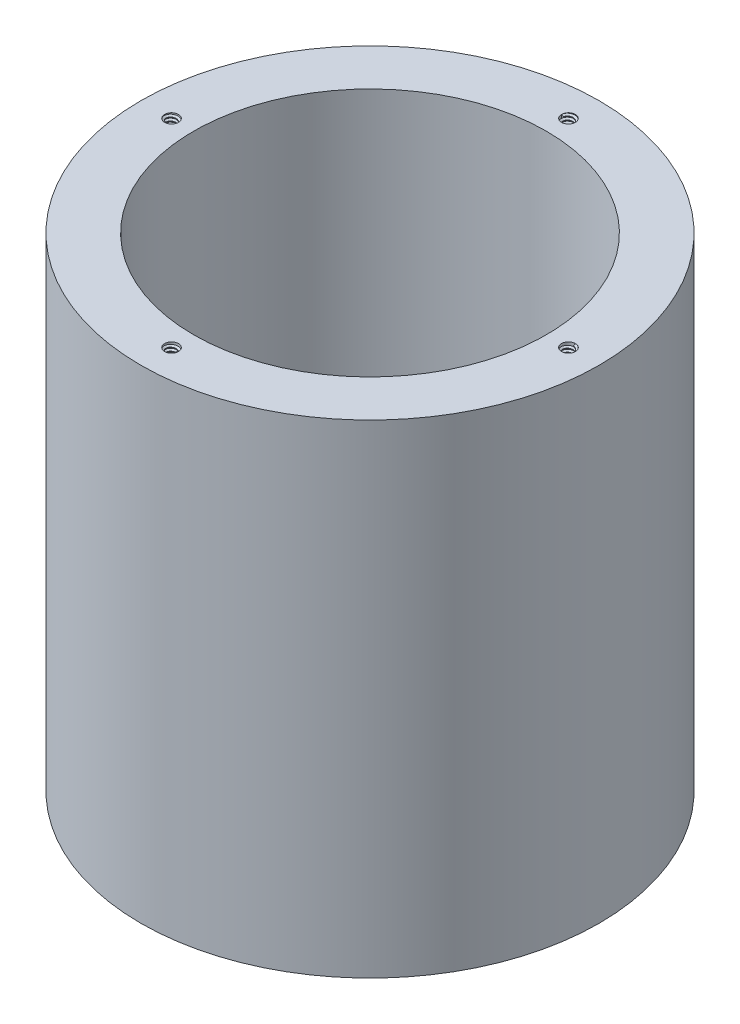
from build123d import *
from build123d.topology import SkipClean

# Parameters (mm, degrees)
SKETCH1_R           = 16.5
SKETCH1_R_2         = 12.7
BOSS_EXTRUDE1_DEPTH = 34.8
SKETCH2_R           = 0.5
CUT_EXTRUDE1_DEPTH  = 2
THREAD1_PITCH       = 0.25
CIRPATTERN1_COUNT   = 4
CUT_EXTRUDE2_START  = -2
SKETCH5_R           = 0.5
CUT_EXTRUDE2_DEPTH  = 2
THREAD2_PITCH       = 0.25
CIRPATTERN2_COUNT   = 4


with BuildPart() as part:
    # Sketch1 → Boss-Extrude1 (new body)
    with BuildSketch(Plane(origin=(0, 0, 0), x_dir=(1, 0, 0), z_dir=(0, 1, 0))):
        with Locations(Location((0, 0, 0), (0, 0, 270))):
            Circle(SKETCH1_R)
        with Locations(Location((0, 0, 0), (0, 0, 270))):
            Circle(SKETCH1_R_2, mode=Mode.SUBTRACT)
    extrude(amount=BOSS_EXTRUDE1_DEPTH)

    # Sketch2 → Cut-Extrude1 (cut)
    with BuildSketch(Plane(origin=(0, 34.8, 0), x_dir=(1, 0, 0), z_dir=(0, 1, 0))):
        with Locations(Location((0, 14.29, 0), (0, 0, 270))):
            Circle(SKETCH2_R)
    cut_extrude1 = extrude(amount=-CUT_EXTRUDE1_DEPTH, mode=Mode.SUBTRACT)

    # Thread1: the profile of Thread Profile1 profile screwed along a right-hand helix of 8 turns, 6 arcs to a turn; built about Z, then put on its axis
    with SkipClean():  # the faces are left unmerged after this step: merging them gives an invalid solid
        thread1_z = Axis((0, 0, 0), (0, 0, 1))
        thread1_corners = [(0.5003, 0, -0.000173205), (0.5003, 0, 0.218923204), (0.364683531, 0, 0.140625), (0.364683531, 0, 0.078125)]
        with BuildLine(mode=Mode.PRIVATE) as thread1_profile:
            Line(thread1_corners[0], thread1_corners[1])
            Line(thread1_corners[1], thread1_corners[2])
            Line(thread1_corners[2], thread1_corners[3])
            Line(thread1_corners[3], thread1_corners[0])
        thread1_cap = Face(thread1_profile.wire())
        thread1_turn_angles = [0, 30, 60, 90, 120, 150, 180, 210, 240, 270, 300, 330, 360]
        thread1_turn_weights = [1, 0.8660254037844387, 1, 0.8660254037844387, 1, 0.8660254037844387, 1, 0.8660254037844387, 1, 0.8660254037844387, 1, 0.8660254037844387, 1]
        thread1_turn_rails = [Edge.make_bspline([Vector(p[0], p[1], 0).rotate(thread1_z, thread1_turn_angles[k]) / thread1_turn_weights[k] + Vector(0, 0, p[2] + THREAD1_PITCH * thread1_turn_angles[k] / 360) for k in range(13)], [0, 0, 0, 1, 1, 2, 2, 3, 3, 4, 4, 5, 5, 6, 6, 6], 2, thread1_turn_weights) for p in thread1_corners]
        thread1_turn_sides = [Face.make_surface_from_curves(thread1_turn_rails[p[0]], thread1_turn_rails[p[1]]) for p in [(0, 1), (1, 2), (2, 3), (3, 0)]]
        thread1 = Plane(origin=(0, 34.8, -14.29), x_dir=(-1, 0, 0), z_dir=(0, -1, 0)) * Solid(Shell([*[p.moved(Location((0, 0, THREAD1_PITCH * i))) for i in range(8) for p in thread1_turn_sides], thread1_cap, thread1_cap.rotate(thread1_z, 2880).moved(Location((0, 0, THREAD1_PITCH * 2880 / 360)))]))
        add(thread1)

    # CirPattern1: Cut-Extrude1, Thread1 ×4 about axis
    with SkipClean():  # the faces are left unmerged after this step: merging them gives an invalid solid
        cirpattern1_axis = Axis((0, 34.8, 0), (0, 1, 0))
        add([cut_extrude1.rotate(cirpattern1_axis, i * 360 / CIRPATTERN1_COUNT) for i in range(1, CIRPATTERN1_COUNT)], mode=Mode.SUBTRACT)
        add([thread1.rotate(cirpattern1_axis, i * 360 / CIRPATTERN1_COUNT) for i in range(1, CIRPATTERN1_COUNT)])

    # Sketch5 → Cut-Extrude2 (cut)
    with SkipClean():  # the faces are left unmerged after this step: merging them gives an invalid solid
        with BuildSketch(Plane.XZ.offset(CUT_EXTRUDE2_START)):
            with Locations(Location((0, 14.29, 0), (0, 0, 270))):
                Circle(SKETCH5_R)
        cut_extrude2 = extrude(amount=CUT_EXTRUDE2_DEPTH, mode=Mode.SUBTRACT)

    # Thread2: the profile of Thread Profile2 profile screwed along a right-hand helix of 8 turns, 6 arcs to a turn; built about Z, then put on its axis
    with SkipClean():  # the faces are left unmerged after this step: merging them gives an invalid solid
        thread2_z = Axis((0, 0, 0), (0, 0, 1))
        thread2_corners = [(0.5003, 0, -0.000173205), (0.5003, 0, 0.218923204), (0.364683531, 0, 0.140625), (0.364683531, 0, 0.078125)]
        with BuildLine(mode=Mode.PRIVATE) as thread2_profile:
            Line(thread2_corners[0], thread2_corners[1])
            Line(thread2_corners[1], thread2_corners[2])
            Line(thread2_corners[2], thread2_corners[3])
            Line(thread2_corners[3], thread2_corners[0])
        thread2_cap = Face(thread2_profile.wire())
        thread2_turn_angles = [0, 30, 60, 90, 120, 150, 180, 210, 240, 270, 300, 330, 360]
        thread2_turn_weights = [1, 0.8660254037844387, 1, 0.8660254037844387, 1, 0.8660254037844387, 1, 0.8660254037844387, 1, 0.8660254037844387, 1, 0.8660254037844387, 1]
        thread2_turn_rails = [Edge.make_bspline([Vector(p[0], p[1], 0).rotate(thread2_z, thread2_turn_angles[k]) / thread2_turn_weights[k] + Vector(0, 0, p[2] + THREAD2_PITCH * thread2_turn_angles[k] / 360) for k in range(13)], [0, 0, 0, 1, 1, 2, 2, 3, 3, 4, 4, 5, 5, 6, 6, 6], 2, thread2_turn_weights) for p in thread2_corners]
        thread2_turn_sides = [Face.make_surface_from_curves(thread2_turn_rails[p[0]], thread2_turn_rails[p[1]]) for p in [(0, 1), (1, 2), (2, 3), (3, 0)]]
        thread2 = Plane(origin=(0, 0, 14.29), x_dir=(1, 0, 0), z_dir=(0, 1, 0)) * Solid(Shell([*[p.moved(Location((0, 0, THREAD2_PITCH * i))) for i in range(8) for p in thread2_turn_sides], thread2_cap, thread2_cap.rotate(thread2_z, 2880).moved(Location((0, 0, THREAD2_PITCH * 2880 / 360)))]))
        add(thread2)

    # CirPattern2: Cut-Extrude2, Thread2 ×4 about axis
    with SkipClean():  # the faces are left unmerged after this step: merging them gives an invalid solid
        cirpattern2_axis = Axis((0, 0, 0), (0, 1, 0))
        add([cut_extrude2.rotate(cirpattern2_axis, i * 360 / CIRPATTERN2_COUNT) for i in range(1, CIRPATTERN2_COUNT)], mode=Mode.SUBTRACT)
        add([thread2.rotate(cirpattern2_axis, i * 360 / CIRPATTERN2_COUNT) for i in range(1, CIRPATTERN2_COUNT)])


solid = part.part
